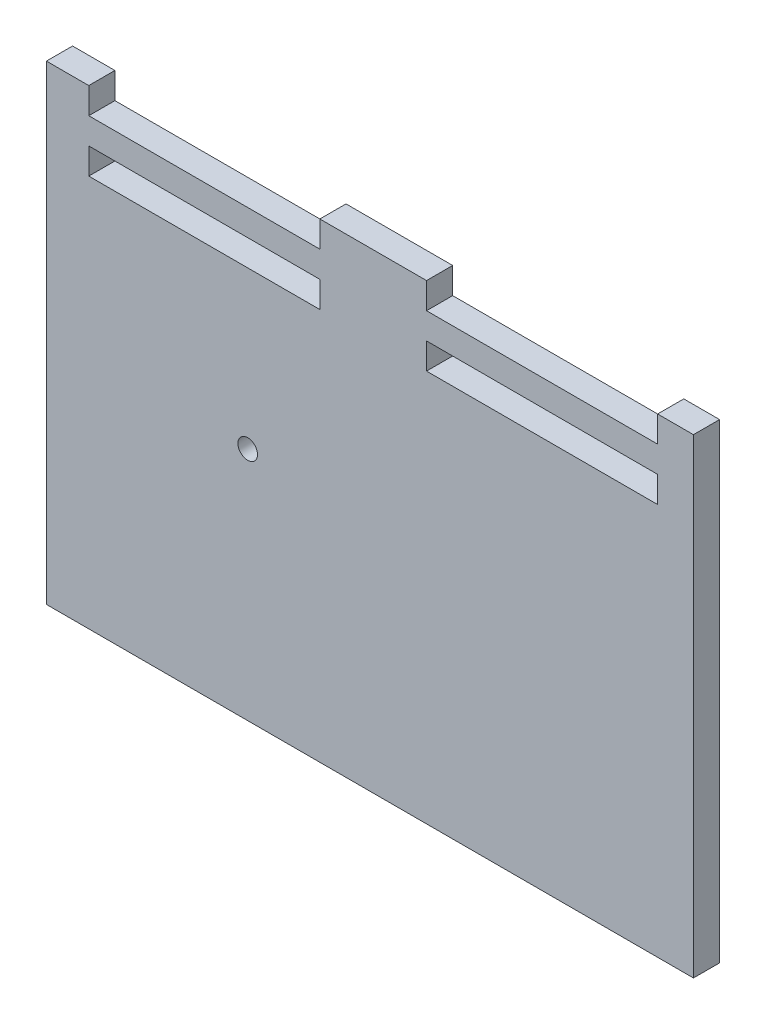
from build123d import *

# Parameters (mm, degrees)
SKETCH1_W           = 304.8
SKETCH1_H           = 228.6
BOSS_EXTRUDE1_DEPTH = 12.7
SKETCH2_R           = 4.7625
CUT_EXTRUDE1_DEPTH  = 12.7
SKETCH7_W           = 112.268
SKETCH7_H           = 12.7
CUT_EXTRUDE2_DEPTH  = 12.7
SKETCH8_W           = 3.175
SKETCH8_H           = 228.6
SKETCH8_W_2         = 6.35
BOSS_EXTRUDE2_DEPTH = 12.7


with BuildPart() as part:
    # Sketch1 → Boss-Extrude1 (new body)
    with BuildSketch(Plane.XY):
        with Locations((152.4, 114.3)):
            Rectangle(SKETCH1_W, SKETCH1_H)
    extrude(amount=BOSS_EXTRUDE1_DEPTH)

    # Sketch2 → Cut-Extrude1 (cut)
    with BuildSketch(Plane.XY.offset(12.7)):
        with Locations((91.44, 114.3)):
            Circle(SKETCH2_R)
    extrude(amount=-CUT_EXTRUDE1_DEPTH, mode=Mode.SUBTRACT)

    # Sketch7 → Cut-Extrude2 (cut)
    with BuildSketch(Plane.XY.offset(12.7)):
        with Locations((70.358, 222.25)):
            Rectangle(SKETCH7_W, SKETCH7_H)
        with Locations((234.442, 222.25)):
            Rectangle(SKETCH7_W, SKETCH7_H)
        with Locations((70.358, 196.85)):
            Rectangle(SKETCH7_W, SKETCH7_H)
        with Locations((234.442, 196.85)):
            Rectangle(SKETCH7_W, SKETCH7_H)
    extrude(amount=-CUT_EXTRUDE2_DEPTH, mode=Mode.SUBTRACT)

    # Sketch8 → Boss-Extrude2 (add)
    with BuildSketch(Plane.XY.offset(12.7)):
        with Locations((306.3875, 114.3)):
            Rectangle(SKETCH8_W, SKETCH8_H)
        with Locations((-3.175, 114.3)):
            Rectangle(SKETCH8_W_2, SKETCH8_H)
    extrude(amount=-BOSS_EXTRUDE2_DEPTH)


solid = part.part
